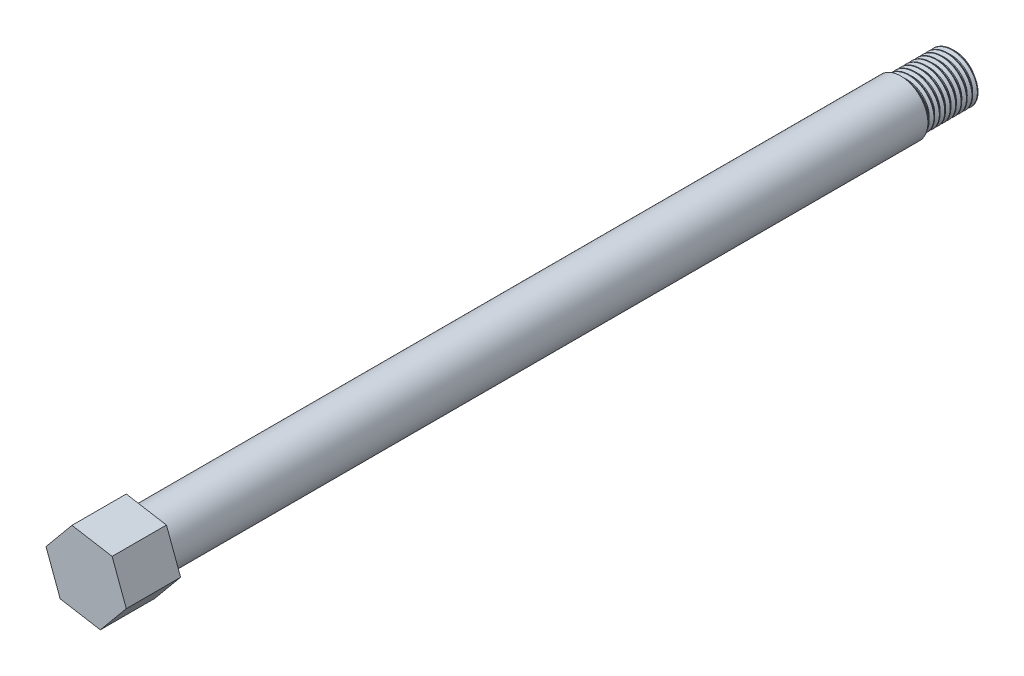
from build123d import *

# Parameters (mm, degrees)
BOSS_EXTRUDE1_DEPTH = 10
SKETCH2_R           = 5
BOSS_EXTRUDE2_DEPTH = 150
SKETCH4_OUTSIDE_W   = 49.048
SKETCH4_OUTSIDE_H   = 48.322
SKETCH4_OUTSIDE_R   = 4
CUT_EXTRUDE1_DEPTH  = 10
THREAD1_PITCH       = 1
SKETCH18_R          = 7.5
CUT_EXTRUDE2_DEPTH  = 10


with BuildPart() as part:
    # Sketch1 → Boss-Extrude1 (new body)
    with BuildSketch(Plane.XY):
        Polygon((-4.783339726, -5.776647909), (2.611053976, -7.030817672), (7.394393701, -1.254169763), (4.783339726, 5.776647909), (-2.611053976, 7.030817672), (-7.394393701, 1.254169763), align=None)
    extrude(amount=BOSS_EXTRUDE1_DEPTH)

    # Sketch2 → Boss-Extrude2 (add)
    with BuildSketch(Plane(origin=(0, 0, 0), x_dir=(-1, 0, 0), z_dir=(0, 0, -1))):
        Circle(SKETCH2_R)
    extrude(amount=BOSS_EXTRUDE2_DEPTH)

    # Sketch4 outside → Cut-Extrude1 (cut)
    with BuildSketch(Plane(origin=(0, 0, -150), x_dir=(-1, 0, 0), z_dir=(0, 0, -1))):
        Rectangle(SKETCH4_OUTSIDE_W, SKETCH4_OUTSIDE_H)
        Circle(SKETCH4_OUTSIDE_R, mode=Mode.SUBTRACT)
    extrude(amount=-CUT_EXTRUDE1_DEPTH, mode=Mode.SUBTRACT)

    # Thread1: the profile of Thread Profile2 profile screwed along a right-hand helix of 11 turns, 8 arcs to a turn; built about Z, then put on its axis
    thread1_z = Axis((0, 0, 0), (0, 0, 1))
    thread1_corners = [(3.9997, 0, -0.000173205), (4.541265875, 0, 0.312499999), (4.541265875, 0, 0.437499999), (3.9997, 0, 0.750173202)]
    with BuildLine(mode=Mode.PRIVATE) as thread1_profile:
        Line(thread1_corners[0], thread1_corners[1])
        Line(thread1_corners[1], thread1_corners[2])
        Line(thread1_corners[2], thread1_corners[3])
        Line(thread1_corners[3], thread1_corners[0])
    thread1_cap = Face(thread1_profile.wire())
    thread1_turn_angles = [0, 22.5, 45, 67.5, 90, 112.5, 135, 157.5, 180, 202.5, 225, 247.5, 270, 292.5, 315, 337.5, 360]
    thread1_turn_weights = [1, 0.9238795325112867, 1, 0.9238795325112867, 1, 0.9238795325112867, 1, 0.9238795325112867, 1, 0.9238795325112867, 1, 0.9238795325112867, 1, 0.9238795325112867, 1, 0.9238795325112867, 1]
    thread1_turn_rails = [Edge.make_bspline([Vector(p[0], p[1], 0).rotate(thread1_z, thread1_turn_angles[k]) / thread1_turn_weights[k] + Vector(0, 0, p[2] + THREAD1_PITCH * thread1_turn_angles[k] / 360) for k in range(17)], [0, 0, 0, 1, 1, 2, 2, 3, 3, 4, 4, 5, 5, 6, 6, 7, 7, 8, 8, 8], 2, thread1_turn_weights) for p in thread1_corners]
    thread1_turn_sides = [Face.make_surface_from_curves(thread1_turn_rails[p[0]], thread1_turn_rails[p[1]]) for p in [(0, 1), (1, 2), (2, 3), (3, 0)]]
    thread1 = Plane(origin=(0, 0, -151), x_dir=(1, 0, 0), z_dir=(0, 0, 1)) * Solid(Shell([*[p.moved(Location((0, 0, THREAD1_PITCH * i))) for i in range(11) for p in thread1_turn_sides], thread1_cap, thread1_cap.rotate(thread1_z, 3960).moved(Location((0, 0, THREAD1_PITCH * 3960 / 360)))]))
    add(thread1)

    # Sketch18 → Cut-Extrude2 (cut)
    with BuildSketch(Plane(origin=(0, 0, -150), x_dir=(-1, 0, 0), z_dir=(0, 0, -1))):
        Circle(SKETCH18_R)
    extrude(amount=CUT_EXTRUDE2_DEPTH, mode=Mode.SUBTRACT)


solid = part.part
